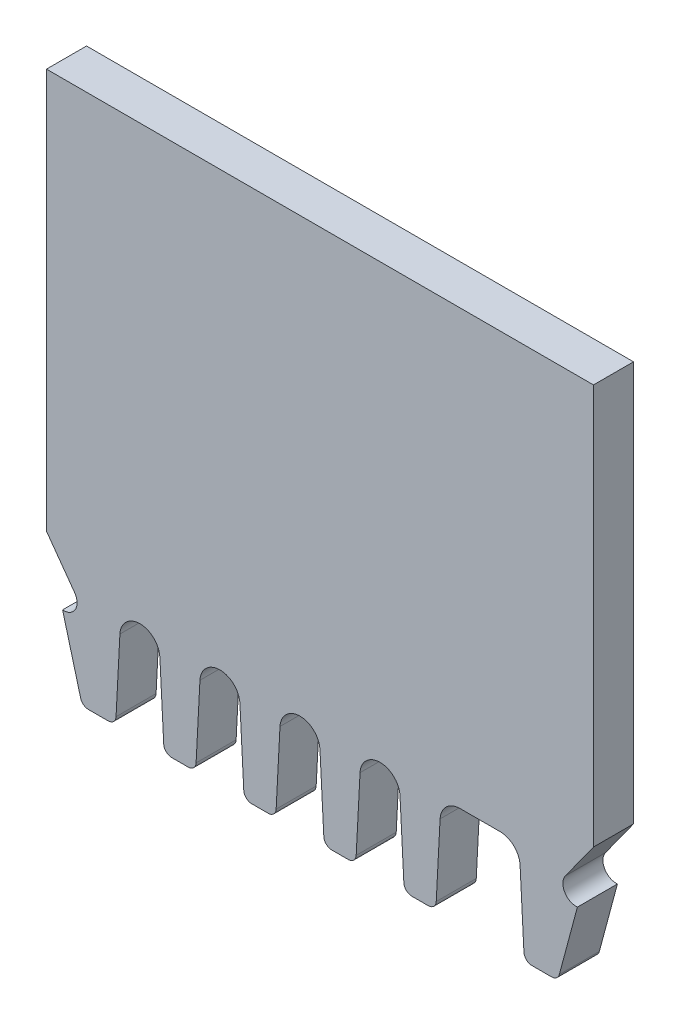
from build123d import *

# Parameters (mm, degrees)
BOSS_EXTRUDE1_DEPTH = 1.5
FILLET1_R           = 0.3


with BuildPart() as part:
    # Sketch1 → Boss-Extrude1 (new body)
    with BuildSketch(Plane.XY):
        with BuildLine():
            Line((15.5, 3.75), (17, 3.75))
            ThreePointArc((17, 3.75), (17.516265932, 3.544030778), (17.748972151, 3.039251967))
            Line((17.748972151, 3.039251967), (17.908252597, 0))
            Line((17.908252597, 0), (19.160254038, 0))
            Line((19.160254038, 0), (19.897114317, 2.75))
            ThreePointArc((19.897114317, 2.75), (19.418820949, 3.001070151), (19.447928842, 3.540471205))
            Line((19.447928842, 3.540471205), (20.5, 5))
            Line((20.5, 5), (20.5, 20))
            Line((20.5, 20), (0, 20))
            Line((0, 20), (0, 5))
            Line((0, 5), (1.052071158, 3.540471205))
            ThreePointArc((1.052071158, 3.540471205), (1.081179051, 3.001070151), (0.602885683, 2.75))
            Line((0.602885683, 2.75), (1.339745962, 0))
            Line((1.339745962, 0), (2.591747403, 0))
            Line((2.591747403, 0), (2.751027849, 3.039251967))
            ThreePointArc((2.751027849, 3.039251967), (3.5, 3.75), (4.248972151, 3.039251967))
            Line((4.248972151, 3.039251967), (4.408252597, 0))
            Line((4.408252597, 0), (5.591747403, 0))
            Line((5.591747403, 0), (5.751027849, 3.039251967))
            ThreePointArc((5.751027849, 3.039251967), (6.5, 3.75), (7.248972151, 3.039251967))
            Line((7.248972151, 3.039251967), (7.408252597, 0))
            Line((7.408252597, 0), (8.591747403, 0))
            Line((8.591747403, 0), (8.751027849, 3.039251967))
            ThreePointArc((8.751027849, 3.039251967), (9.5, 3.75), (10.248972151, 3.039251967))
            Line((10.248972151, 3.039251967), (10.408252597, 0))
            Line((10.408252597, 0), (11.591747403, 0))
            Line((11.591747403, 0), (11.751027849, 3.039251967))
            ThreePointArc((11.751027849, 3.039251967), (12.5, 3.75), (13.248972151, 3.039251967))
            Line((13.248972151, 3.039251967), (13.408252597, 0))
            Line((13.408252597, 0), (14.591747403, 0))
            Line((14.591747403, 0), (14.751027849, 3.039251967))
            ThreePointArc((14.751027849, 3.039251967), (14.983734068, 3.544030778), (15.5, 3.75))
        make_face()
    extrude(amount=BOSS_EXTRUDE1_DEPTH)

    # Fillet1
    fillet1_edges = [part.edges().sort_by_distance(p)[0] for p in [
        (19.160254038, 0, 0.75),
        (17.908252597, 0, 0.75),
        (14.591747403, 0, 0.75),
        (13.408252597, 0, 0.75),
        (11.591747403, 0, 0.75),
        (10.408252597, 0, 0.75),
        (8.591747403, 0, 0.75),
        (7.408252597, 0, 0.75),
        (5.591747403, 0, 0.75),
        (4.408252597, 0, 0.75),
        (2.591747403, 0, 0.75),
        (1.339745962, 0, 0.75),
    ]]
    fillet(fillet1_edges, radius=FILLET1_R)


solid = part.part
